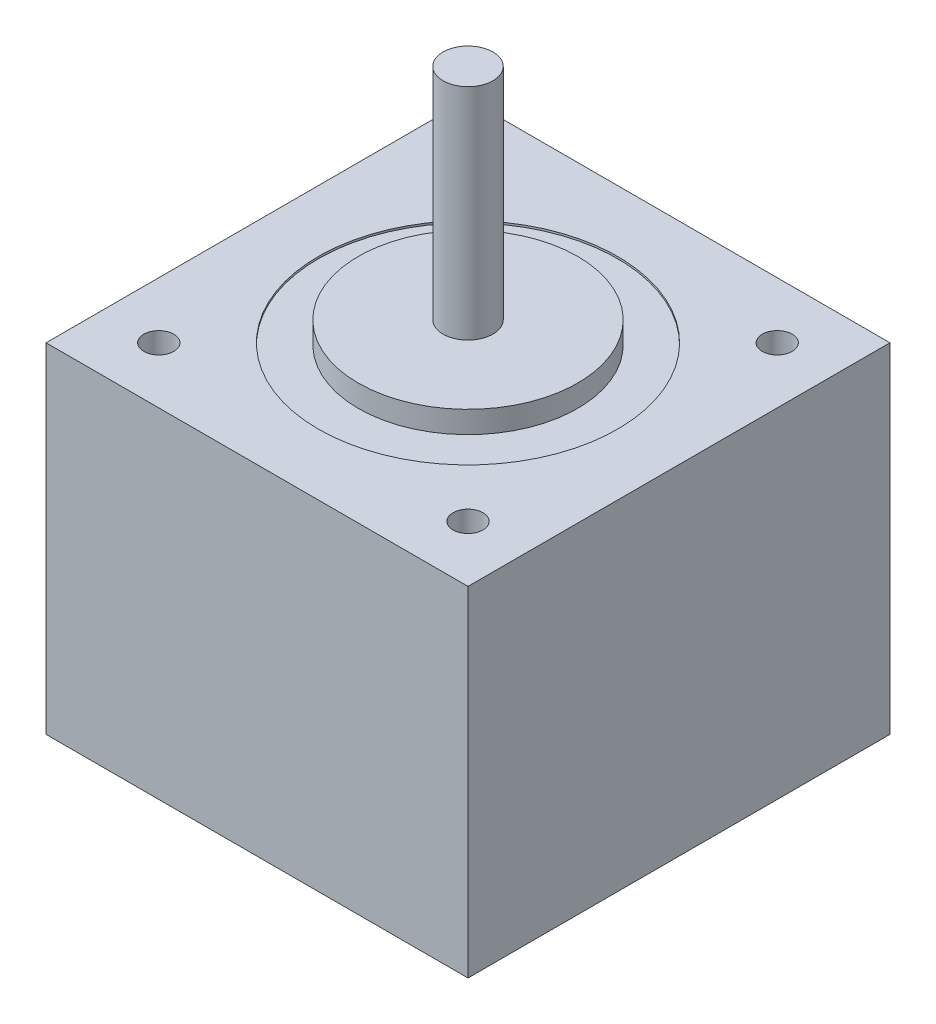
from build123d import *

# Parameters (mm, degrees)
SKETCH1_W            = 42.3
SKETCH1_H            = 42.3
BODY_DEPTH           = 34
SKETCH2_R            = 1.5
MOUNTING_HOLES_DEPTH = 4
SKETCH3_R            = 11
CENTER_THING_DEPTH   = 2
SKETCH4_R            = 2.5
SHAFT_DEPTH          = 22
LARGE_DIVOT_START    = -0.2
SKETCH5_R            = 15
SKETCH5_R_2          = 11
LARGE_DIVOT_DEPTH    = 0.2


with BuildPart() as part:
    # Sketch1 → body (new body)
    with BuildSketch(Plane(origin=(0, 0, 0), x_dir=(1, 0, 0), z_dir=(0, 1, 0))):
        Rectangle(SKETCH1_W, SKETCH1_H)
    extrude(amount=BODY_DEPTH)

    # Sketch2 → mounting-holes (cut)
    with BuildSketch(Plane(origin=(0, 34, 0), x_dir=(1, 0, 0), z_dir=(0, 1, 0))):
        with Locations((-15.5, 15.5)):
            Circle(SKETCH2_R)
        with Locations((15.5, 15.5)):
            Circle(SKETCH2_R)
        with Locations((15.5, -15.5)):
            Circle(SKETCH2_R)
        with Locations((-15.5, -15.5)):
            Circle(SKETCH2_R)
    extrude(amount=-MOUNTING_HOLES_DEPTH, mode=Mode.SUBTRACT)

    # Sketch3 → center-thing (add)
    with BuildSketch(Plane(origin=(0, 34, 0), x_dir=(1, 0, 0), z_dir=(0, 1, 0))):
        Circle(SKETCH3_R)
    extrude(amount=CENTER_THING_DEPTH)

    # Sketch4 → shaft (add)
    with BuildSketch(Plane(origin=(0, 36, 0), x_dir=(1, 0, 0), z_dir=(0, 1, 0))):
        Circle(SKETCH4_R)
    extrude(amount=SHAFT_DEPTH)

    # Sketch5 → large-divot (cut)
    with BuildSketch(Plane(origin=(0, 34, 0), x_dir=(1, 0, 0), z_dir=(0, 1, 0)).offset(LARGE_DIVOT_START)):
        Circle(SKETCH5_R)
        Circle(SKETCH5_R_2, mode=Mode.SUBTRACT)
    extrude(amount=LARGE_DIVOT_DEPTH, mode=Mode.SUBTRACT)


solid = part.part
